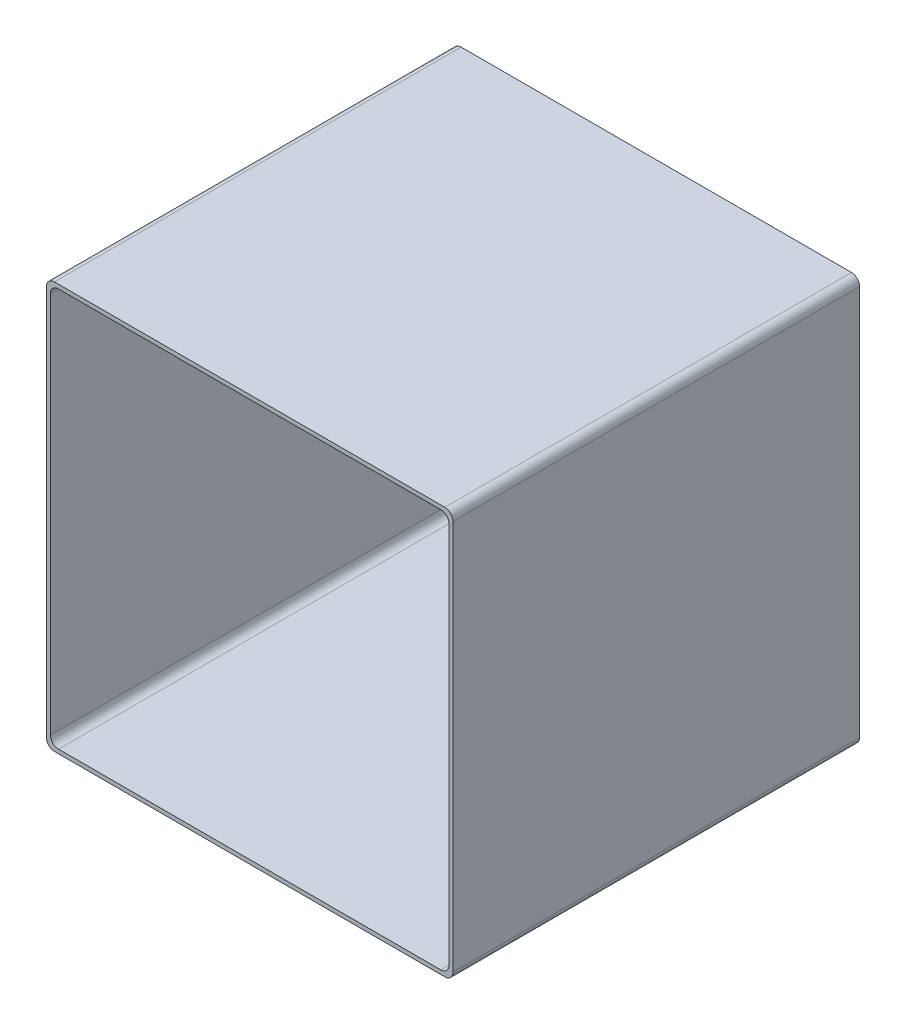
from build123d import *

# Parameters (mm, degrees)
SKETCH2_W           = 500
SKETCH2_H           = 500
SKETCH2_W_2         = 490
SKETCH2_H_2         = 490
BOSS_EXTRUDE1_DEPTH = 500
FILLET1_R           = 10


with BuildPart() as part:
    # Sketch2 → Boss-Extrude1 (new body)
    with BuildSketch(Plane.XY):
        with Locations((250, 250)):
            Rectangle(SKETCH2_W, SKETCH2_H)
        with Locations((250, 250)):
            Rectangle(SKETCH2_W_2, SKETCH2_H_2, mode=Mode.SUBTRACT)
    extrude(amount=BOSS_EXTRUDE1_DEPTH)

    # Fillet1
    fillet1_edges = [part.edges().sort_by_distance(p)[0] for p in [
        (495, 5, 250),
        (495, 495, 250),
        (5, 495, 250),
        (5, 5, 250),
        (0, 0, 250),
        (0, 500, 250),
        (500, 0, 250),
        (500, 500, 250),
    ]]
    fillet(fillet1_edges, radius=FILLET1_R)


solid = part.part
